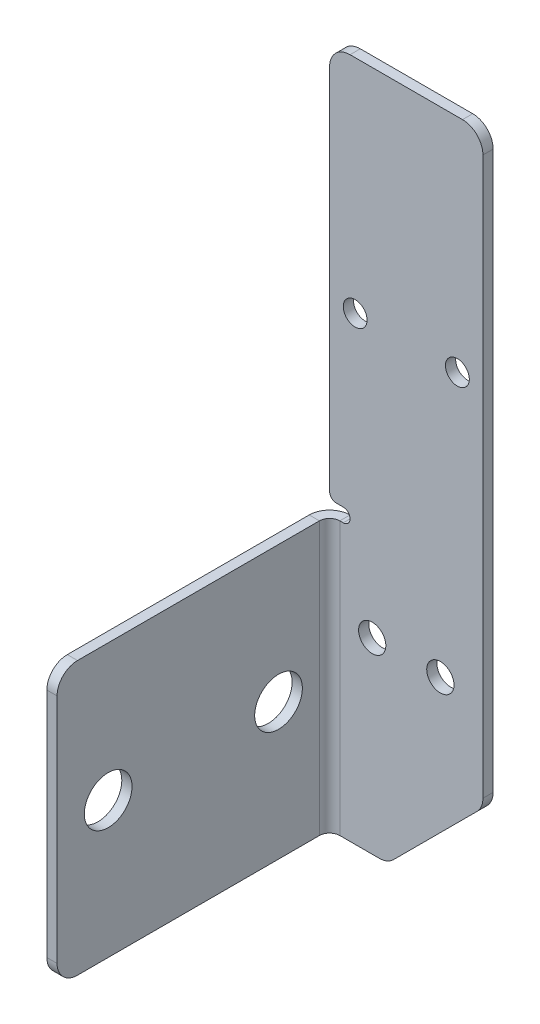
from build123d import *

# Parameters (mm, degrees)
BOSS_EXTRU_1_DEPTH           = 1.5
ESQUISSE2_W                  = 40
ESQUISSE2_H                  = 40
BOSS_EXTRU_2_DEPTH           = 1.5
ENL_V_MAT_EXTRU_1_DEPTH      = 111.344913793
ENL_V_MAT_EXTRU_1_DEPTH_BACK = 111.344913793
ESQUISSE3_W                  = 1.5
ESQUISSE3_H                  = 60
ENL_V_MAT_EXTRU_2_DEPTH      = 111.344913793
ENL_V_MAT_EXTRU_2_DEPTH_BACK = 111.344913793
ESQUISSE4_R                  = 1.75
ESQUISSE4_R_2                = 2
ENL_V_MAT_EXTRU_3_DEPTH      = 111.582548352
ENL_V_MAT_EXTRU_3_DEPTH_BACK = 111.582548352
ESQUISSE5_R                  = 3.5
ESQUISSE14_W                 = 3
ESQUISSE14_H                 = 2
ENL_V_MAT_EXTRU_4_DEPTH      = 111.344913793
CONG_4_R                     = 1
CONG_5_R                     = 3
CONVERTIR_VOLUME2_DEPTH      = 40
CONVERTIR_VOLUME2_2_DEPTH    = 40


# Read off the part's stored shape, not the designer's step: Convertir-Volume2
with BuildPart() as part:
    # Esquisse1 → Boss.-Extru.1 (new body)
    with BuildSketch(Plane.XY):
        Polygon((0, 0), (0, 100), (24, 100), (24, 14), (10, 0), align=None)
    extrude(amount=BOSS_EXTRU_1_DEPTH)

    # Esquisse2 → Boss.-Extru.2 (add)
    with BuildSketch(Plane.ZY):
        with Locations((21.5, 20)):
            Rectangle(ESQUISSE2_W, ESQUISSE2_H)
    extrude(amount=-BOSS_EXTRU_2_DEPTH)

    # Esquisse3 → Enlèv. mat.-Extru.1 (cut, two sides: drawn at the far end of the back side and taken through both)
    with BuildSketch(Plane.XY.offset(1.5).offset(-ENL_V_MAT_EXTRU_1_DEPTH_BACK)):
        with Locations((0.75, 70)):
            Rectangle(ESQUISSE3_W, ESQUISSE3_H)
    extrude(amount=ENL_V_MAT_EXTRU_1_DEPTH + ENL_V_MAT_EXTRU_1_DEPTH_BACK, mode=Mode.SUBTRACT)

    # Esquisse4 → Enlèv. mat.-Extru.2 (cut, two sides: drawn at the far end of the back side and taken through both)
    with BuildSketch(Plane.XY.offset(1.5).offset(-ENL_V_MAT_EXTRU_2_DEPTH_BACK)):
        with Locations((5.25, 67.5)):
            Circle(ESQUISSE4_R)
        with Locations(Location((20.25, 67.5, 0), (0, 0, 180))):
            Circle(ESQUISSE4_R)
        with Locations((7.75, 27.5)):
            Circle(ESQUISSE4_R_2)
        with Locations(Location((17.75, 27.5, 0), (0, 0, 180))):
            Circle(ESQUISSE4_R_2)
    extrude(amount=ENL_V_MAT_EXTRU_2_DEPTH + ENL_V_MAT_EXTRU_2_DEPTH_BACK, mode=Mode.SUBTRACT)

    # Esquisse5 → Enlèv. mat.-Extru.3 (cut, two sides: drawn at the far end of the back side and taken through both)
    with BuildSketch(Plane(origin=(1.5, 0, 0), x_dir=(0, 0, -1), z_dir=(1, 0, 0)).offset(-ENL_V_MAT_EXTRU_3_DEPTH_BACK)):
        with Locations((-34, 20)):
            Circle(ESQUISSE5_R)
        with Locations((-9, 20)):
            Circle(ESQUISSE5_R)
    extrude(amount=ENL_V_MAT_EXTRU_3_DEPTH + ENL_V_MAT_EXTRU_3_DEPTH_BACK, mode=Mode.SUBTRACT)

    # Esquisse14 → Enlèv. mat.-Extru.4 (cut, through all)
    with BuildSketch(Plane.XY.offset(1.5)):
        with Locations((3, 41)):
            Rectangle(ESQUISSE14_W, ESQUISSE14_H)
    extrude(amount=-ENL_V_MAT_EXTRU_4_DEPTH, mode=Mode.SUBTRACT)

    # Congé4
    cong_4_edges = [part.edges().sort_by_distance(p)[0] for p in [
        (1.5, 42, 0.75),
        (4.5, 42, 0.75),
        (4.5, 40, 0.75),
    ]]
    fillet(cong_4_edges, radius=CONG_4_R - 0.0001)  # a hair under: the kernel refuses the full size

    # Congé5
    cong_5_edges = [part.edges().sort_by_distance(p)[0] for p in [
        (0.75, 40, 41.5),
        (0.75, 0, 41.5),
        (1.5, 100, 0.75),
        (24, 100, 0.75),
        (24, 14, 0.75),
        (10, 0, 0.75),
    ]]
    fillet(cong_5_edges, radius=CONG_5_R)

    # Convertir-Volume2 outline → Convertir-Volume2 (cut)
    with BuildSketch(Plane(origin=(0, 0, 0), x_dir=(1, 0, 0), z_dir=(0, 1, 0))):
        with BuildLine():
            Line((0, 0), (0, -3))
            ThreePointArc((0, -3), (0.878679656, -0.878679656), (3, 0))
            Line((3, 0), (0, 0))
        make_face()
    extrude(amount=CONVERTIR_VOLUME2_DEPTH, mode=Mode.SUBTRACT)

    # Convertir-Volume2 2 outline → Convertir-Volume2 2 (add)
    with BuildSketch(Plane(origin=(0, 0, 0), x_dir=(1, 0, 0), z_dir=(0, 1, 0))):
        with BuildLine():
            Line((1.5, -1.5), (1.5, -3))
            ThreePointArc((1.5, -3), (1.939339828, -1.939339828), (3, -1.5))
            Line((3, -1.5), (1.5, -1.5))
        make_face()
    extrude(amount=CONVERTIR_VOLUME2_2_DEPTH)


solid = part.part
